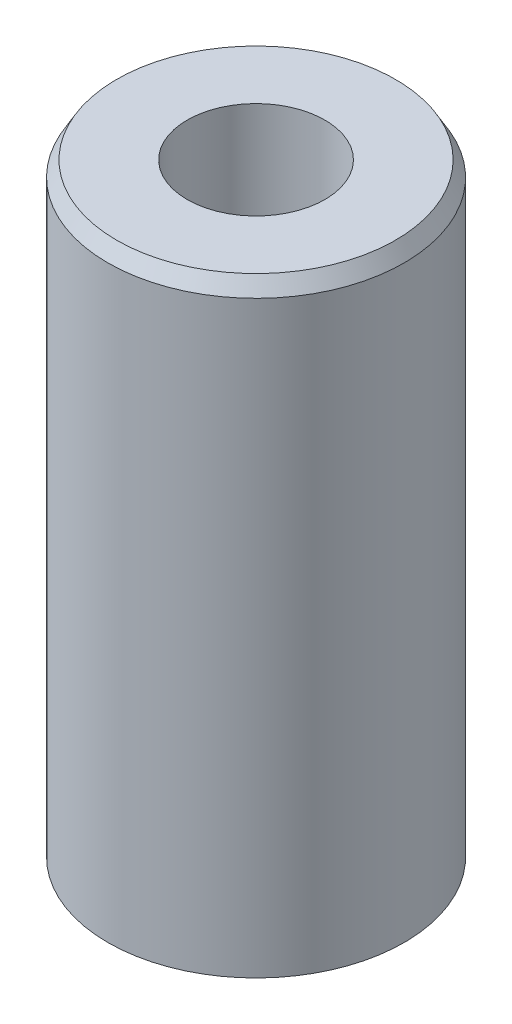
from build123d import *
from OCP.BRepFilletAPI import BRepFilletAPI_MakeChamfer

# Parameters (mm, degrees)
SKETCH1_R           = 40
BOSS_EXTRUDE1_DEPTH = 165.387907085
SKETCH2_R           = 18.596848852
CUT_EXTRUDE1_DEPTH  = 175.794621799
CHAMFER1_SIZE       = 4.109797751
CHAMFER1_SIZE2      = 2.372792838


with BuildPart() as part:
    # Sketch1 → Boss-Extrude1 (new body)
    with BuildSketch(Plane(origin=(0, 0, 0), x_dir=(1, 0, 0), z_dir=(0, 1, 0))):
        Circle(SKETCH1_R)
    extrude(amount=BOSS_EXTRUDE1_DEPTH)

    # Sketch2 → Cut-Extrude1 (cut, through all)
    with BuildSketch(Plane(origin=(0, 0, 0), x_dir=(1, 0, 0), z_dir=(0, 1, 0))):
        Circle(SKETCH2_R)
    extrude(amount=CUT_EXTRUDE1_DEPTH, mode=Mode.SUBTRACT)

    # Chamfer1: one chamfer whose edges measure the first distance from different faces: ONE call of the kernel's chamfer builder (chamfer() names one face for all edges)
    chamfer1_edges_1 = [part.edges().sort_by_distance(p)[0] for p in [
        (-40, 165.387907085, 0),
    ]]
    chamfer1_side_1 = [part.faces().sort_by_distance(p)[0] for p in [
        (-40, 82.693953542, 0),
    ]]
    chamfer1_edges_2 = [part.edges().sort_by_distance(p)[0] for p in [
        (-40, 0, 0),
    ]]
    chamfer1_side_2 = [part.faces().sort_by_distance(p)[0] for p in [
        (-38.86862915, 0, 0),
    ]]
    chamfer1 = BRepFilletAPI_MakeChamfer(part.part.solid().wrapped)
    for e in chamfer1_edges_1:
        chamfer1.Add(CHAMFER1_SIZE, CHAMFER1_SIZE2, e.wrapped, chamfer1_side_1[0].wrapped)  # the first distance lies on this face
    for e in chamfer1_edges_2:
        chamfer1.Add(CHAMFER1_SIZE, CHAMFER1_SIZE2, e.wrapped, chamfer1_side_2[0].wrapped)  # the first distance lies on this face
    add(Compound.cast(chamfer1.Shape()), mode=Mode.REPLACE)


solid = part.part
